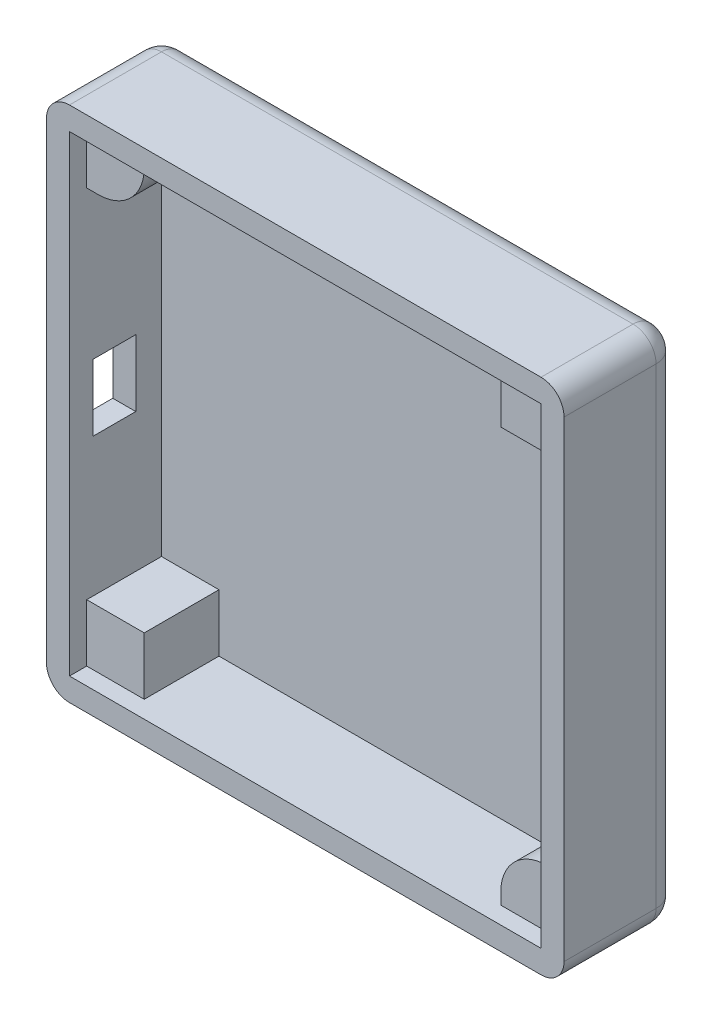
from build123d import *

# Parameters (mm, degrees)
SCHIZZO2_W                   = 45
SCHIZZO2_H                   = 45
ESTRUSIONE_ESTRUSIONE2_DEPTH = 10
SVUOTA1_T                    = -2
RACCORDO1_R                  = 2
RACCORDO2_R                  = 2
SCHIZZO3_W                   = 5
SCHIZZO3_H                   = 5
ESTRUSIONE_ESTRUSIONE3_DEPTH = 6.5
SCHIZZO4_W                   = 5
SCHIZZO4_H                   = 5
ESTRUSIONE_ESTRUSIONE4_DEPTH = 6.5
RACCORDO3_R                  = 4
SCHIZZO5_W                   = 5
SCHIZZO5_H                   = 5
ESTRUSIONE_ESTRUSIONE5_DEPTH = 6.5
SCHIZZO7_W                   = 3.721232587
SCHIZZO7_H                   = 5.791483481
TAGLIO_ESTRUSIONE1_DEPTH     = 3


with BuildPart() as part:
    # Schizzo2 → Estrusione-Estrusione2 (new body)
    with BuildSketch(Plane.XY):
        with Locations((22.5, 22.5)):
            Rectangle(SCHIZZO2_W, SCHIZZO2_H)
    extrude(amount=ESTRUSIONE_ESTRUSIONE2_DEPTH)

    # Svuota1
    svuota1_openings = [part.faces().sort_by_distance(p)[0] for p in [
        (22.5, 22.5, 10),
    ]]
    offset(amount=SVUOTA1_T, openings=svuota1_openings, kind=Kind.INTERSECTION)

    # Raccordo1
    raccordo1_edges = [part.edges().sort_by_distance(p)[0] for p in [
        (45, 45, 5),
        (45, 0, 5),
        (0, 0, 5),
        (0, 45, 5),
    ]]
    fillet(raccordo1_edges, radius=RACCORDO1_R)

    # Raccordo2
    raccordo2_edges = [part.edges().sort_by_distance(p)[0] for p in [
        (44.414213562, 0.585786438, 0),
        (22.5, 0, 0),
        (0.585786438, 0.585786438, 0),
        (0, 22.5, 0),
        (0.585786438, 44.414213562, 0),
        (22.5, 45, 0),
        (44.414213562, 44.414213562, 0),
        (45, 22.5, 0),
    ]]
    fillet(raccordo2_edges, radius=RACCORDO2_R)

    # Schizzo3 → Estrusione-Estrusione3 (add)
    with BuildSketch(Plane.XY.offset(2)):
        with Locations((4.5, 40.5)):
            Rectangle(SCHIZZO3_W, SCHIZZO3_H)
    extrude(amount=ESTRUSIONE_ESTRUSIONE3_DEPTH)

    # Schizzo4 → Estrusione-Estrusione4 (add)
    with BuildSketch(Plane.XY.offset(2)):
        with Locations((40.5, 4.5)):
            Rectangle(SCHIZZO4_W, SCHIZZO4_H)
    extrude(amount=ESTRUSIONE_ESTRUSIONE4_DEPTH)

    # Raccordo3
    raccordo3_edges = [part.edges().sort_by_distance(p)[0] for p in [
        (38, 7, 5.25),
        (7, 38, 5.25),
    ]]
    fillet(raccordo3_edges, radius=RACCORDO3_R)

    # Schizzo5 → Estrusione-Estrusione5 (add)
    with BuildSketch(Plane.XY.offset(2)):
        with Locations((40.5, 40.5)):
            Rectangle(SCHIZZO5_W, SCHIZZO5_H)
        with Locations((4.5, 4.5)):
            Rectangle(SCHIZZO5_W, SCHIZZO5_H)
    extrude(amount=ESTRUSIONE_ESTRUSIONE5_DEPTH)

    # Schizzo7 → Taglio-Estrusione1 (cut)
    with BuildSketch(Plane.ZY):
        with Locations((6.095303288, 21.928649717)):
            Rectangle(SCHIZZO7_W, SCHIZZO7_H)
    extrude(amount=-TAGLIO_ESTRUSIONE1_DEPTH, mode=Mode.SUBTRACT)


solid = part.part
